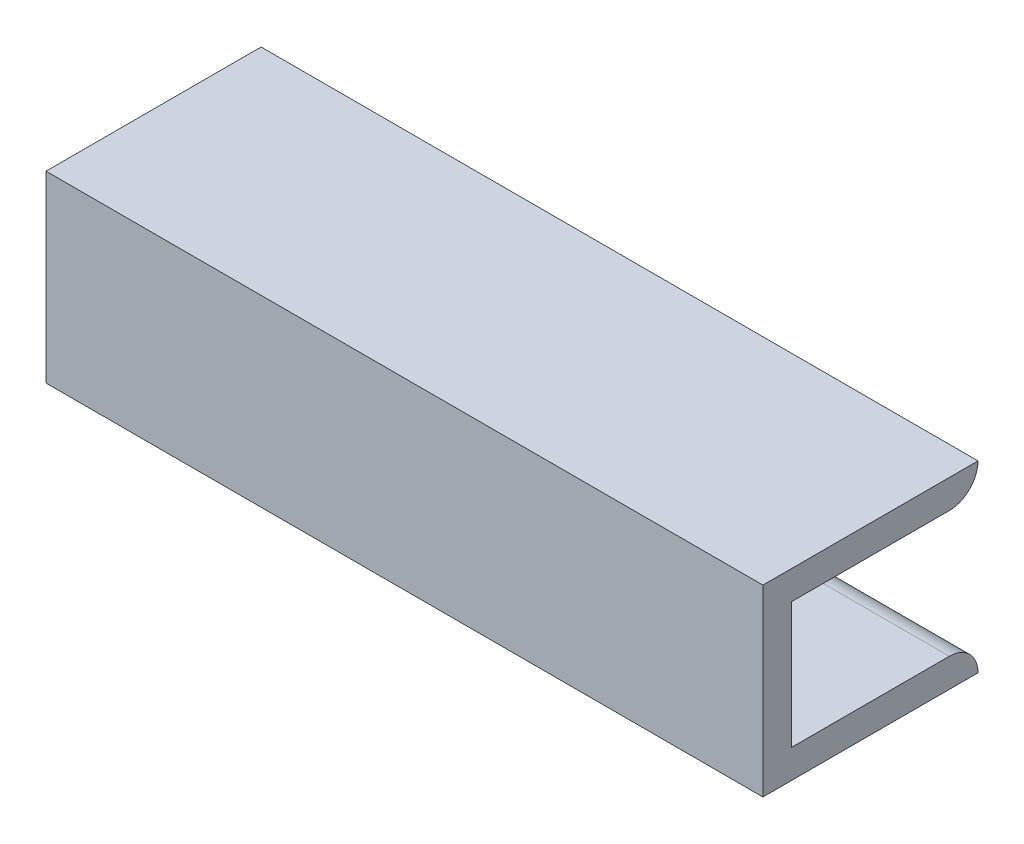
from build123d import *

# Parameters (mm, degrees)
SKETCH_1_W        = 50
SKETCH_1_H        = 2
EXTRUDE_1_DEPTH   = 15
EXTRUDE_1_2_DEPTH = 15
SKETCH_2_W        = 50
SKETCH_2_H        = 12.8
EXTRUDE_2_DEPTH   = 2
FILLET_1_R        = 2


with BuildPart() as part:
    # 草图1 → 凸台-拉伸1 (new body)
    with BuildSketch(Plane.XY):
        with Locations((25, -1)):
            Rectangle(SKETCH_1_W, SKETCH_1_H)
    extrude(amount=EXTRUDE_1_DEPTH)



with BuildPart() as body_2:
    # 草图1 → Extrude 1 2 (new body)
    with BuildSketch(Plane.XY):
        with Locations((25, 9.8)):
            Rectangle(SKETCH_1_W, SKETCH_1_H)
    extrude(amount=EXTRUDE_1_2_DEPTH)


with BuildPart() as part_1:
    add(part.part)

    add(body_2.part)  # 凸台-拉伸2 merges body 2
    # 草图2 → 凸台-拉伸2 (add)
    with BuildSketch(Plane.XY.offset(15)):
        with Locations((25, 4.4)):
            Rectangle(SKETCH_2_W, SKETCH_2_H)
    extrude(amount=-EXTRUDE_2_DEPTH)

    # 圆角1
    fillet_1_edges = [part_1.edges().sort_by_distance(p)[0] for p in [
        (25, 0, 0),
        (25, 8.8, 0),
    ]]
    fillet(fillet_1_edges, radius=FILLET_1_R - 0.0001)  # a hair under: the kernel refuses the full size


solid = part_1.part
